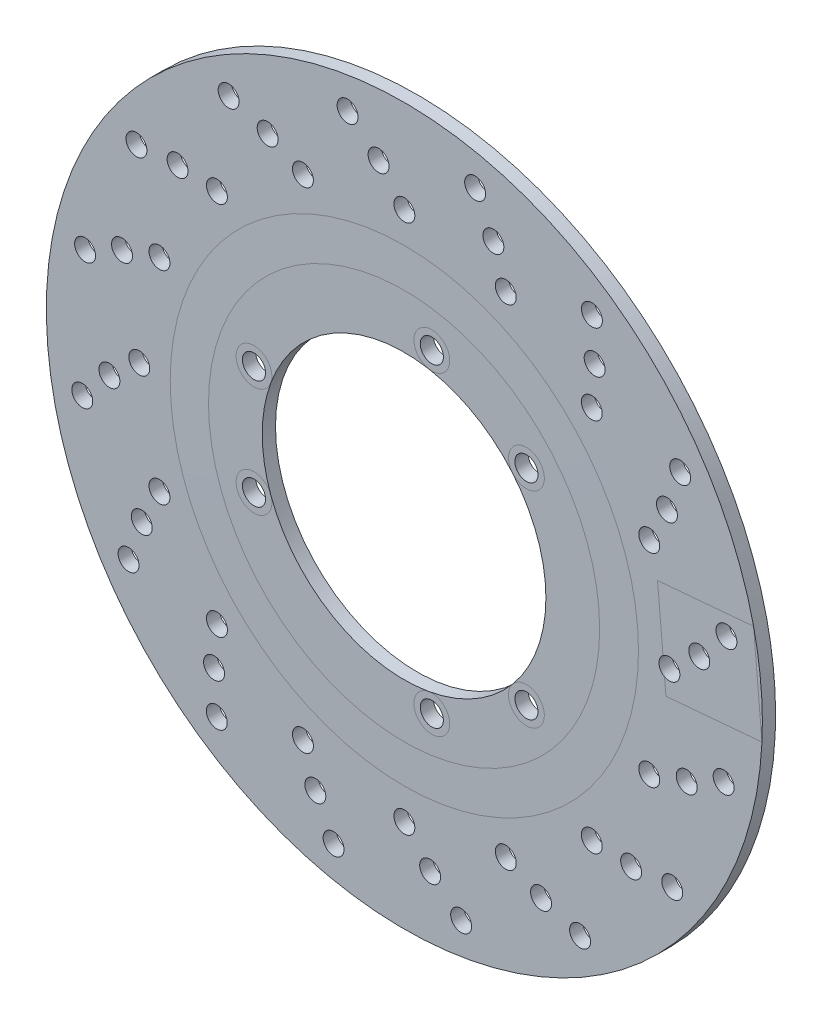
from build123d import *

# Parameters (mm, degrees)
SKETCH3_R                  = 51.5
CUT_EXTRUDE1_DEPTH         = 184.910412973
SKETCH4_R                  = 4.2
CUT_EXTRUDE2_DEPTH         = 184.910412973
F_7_6_7_6_DIAMETER_HOLE1_D = 7.6
CIRPATTERN1_COUNT          = 16


with BuildPart() as part:
    # Sketch2 → Revolve1 (revolve)
    with BuildSketch(Plane(origin=(0, 0, 0), x_dir=(1, 0, 0), z_dir=(0, 1, 0))):
        Polygon((0, 0), (0, 4.8), (-71, 4.8), (-85, 4.9), (-130, 4.9), (-130, 0.1), (-85.017142638, 0.1), (-71.017142638, 0), align=None)
    revolve(axis=Axis((0, 0, 0), (0, 0, -1)))

    # Sketch3 → Cut-Extrude1 (cut, through all)
    with BuildSketch(Plane(origin=(0, 0, -4.8), x_dir=(-1, 0, 0), z_dir=(0, 0, -1))):
        Circle(SKETCH3_R)
    extrude(amount=-CUT_EXTRUDE1_DEPTH, mode=Mode.SUBTRACT)

    # Sketch4 → Cut-Extrude2 (cut, through all)
    with BuildSketch(Plane(origin=(0, 0, -4.8), x_dir=(-1, 0, 0), z_dir=(0, 0, -1))):
        with Locations((-10.071594305, -57.118849675)):
            Circle(SKETCH4_R)
        with Locations((-44.430577701, -37.281681362)):
            Circle(SKETCH4_R)
        with Locations((54.502172006, -19.837168313)):
            Circle(SKETCH4_R)
        with Locations((54.502172006, 19.837168313)):
            Circle(SKETCH4_R)
        with Locations((-10.071594305, 57.118849675)):
            Circle(SKETCH4_R)
        with Locations((-44.430577701, 37.281681362)):
            Circle(SKETCH4_R)
    extrude(amount=-CUT_EXTRUDE2_DEPTH, mode=Mode.SUBTRACT)

    # Ø7.6 (7.6) Diameter Hole1 (through all)
    with Locations(Plane(origin=(0, 0, -4.9), x_dir=(-1, 0, 0), z_dir=(0, 0, -1))):
        with Locations((116.94592067, -20.620721098), (96.25, 0), (107.090930045, -9.369242345)):
            f_7_6_7_6_diameter_hole1 = Hole(F_7_6_7_6_DIAMETER_HOLE1_D / 2)

    # CirPattern1: Ø7.6 (7.6) Diameter Hole1 ×16 about axis
    cirpattern1_axis = Axis((0, 0, -4.8), (0, 0, -1))
    for i in range(1, CIRPATTERN1_COUNT):
        add(f_7_6_7_6_diameter_hole1.rotate(cirpattern1_axis, i * 360 / CIRPATTERN1_COUNT), mode=Mode.SUBTRACT)


solid = part.part
